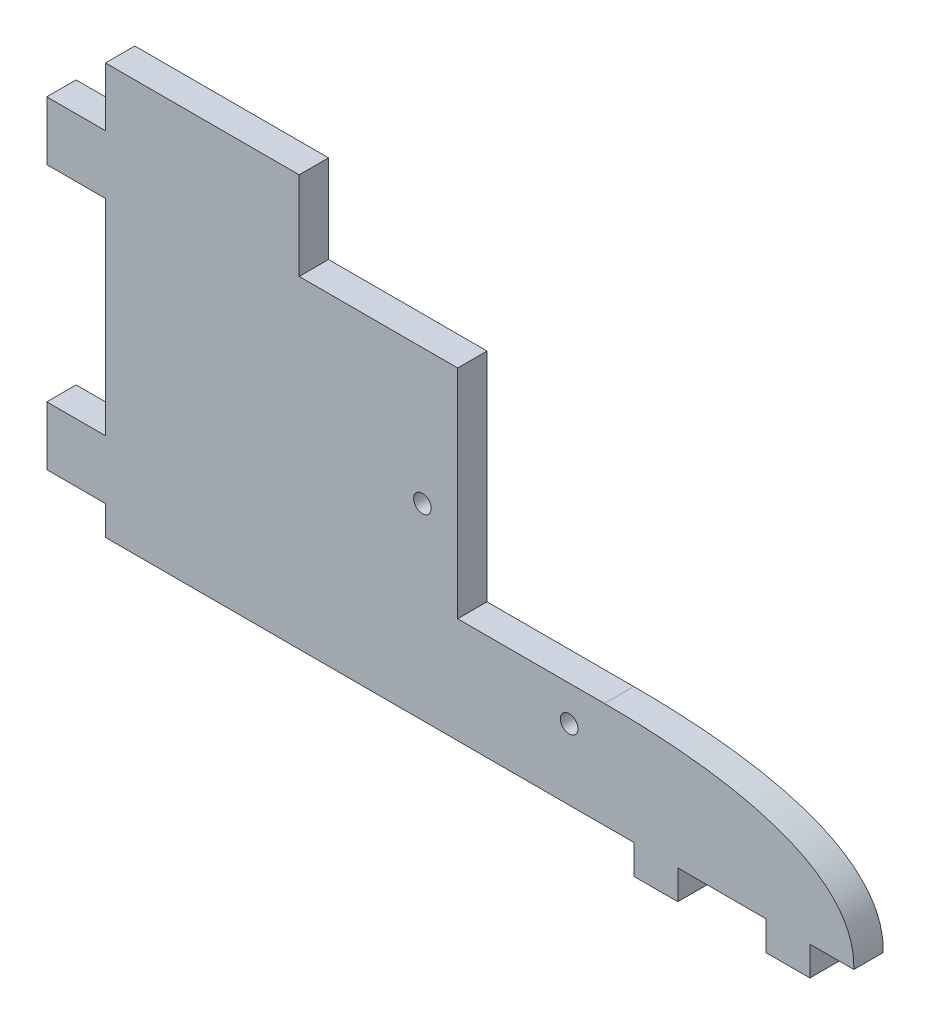
from build123d import *

# Parameters (mm, degrees)
ESQUISSE1_R        = 1.5
BOSS_EXTRU_1_DEPTH = 5
BOSS_EXTRU_2_DEPTH = 5


with BuildPart() as part:
    # Esquisse1 → Boss.-Extru.1 (new body)
    with BuildSketch(Plane.XY):
        Polygon((0, 0), (37, 0), (37, 18), (12, 18), (12, 55), (0, 55), align=None)
        with Locations((6, 32)):
            Circle(ESQUISSE1_R, mode=Mode.SUBTRACT)
        with Locations((31, 12)):
            Circle(ESQUISSE1_R, mode=Mode.SUBTRACT)
    extrude(amount=BOSS_EXTRU_1_DEPTH)

    # Esquisse2 → Boss.-Extru.2 (add)
    with BuildSketch(Plane.XY.offset(5)):
        with BuildLine():
            Line((37, 0), (42, 0))
            Line((42, 0), (42, -5))
            Line((42, -5), (49.5, -5))
            Line((49.5, -5), (49.5, 0))
            Line((49.5, 0), (64.5, 0))
            Line((64.5, 0), (64.5, -5))
            Line((64.5, -5), (72, -5))
            Line((72, -5), (72, 0))
            Line((72, 0), (79.5, 0))
            add(Edge.make_bspline(
                [(37, 18), (79.239532327, 18), (79.5, 3.874285435), (79.5, 0)],
                knots=[0, 0, 0, 0, 1, 1, 1, 1], degree=3))
            Line((37, 18), (37, 0))
        make_face()
        Polygon((0, 0), (-48, 0), (-48, 5), (-58, 5), (-58, 15), (-48, 15), (-48, 50), (-58, 50), (-58, 60), (-48, 60), (-48, 70), (-15, 70), (-15, 55), (0, 55), align=None)
    extrude(amount=-BOSS_EXTRU_2_DEPTH)


solid = part.part
